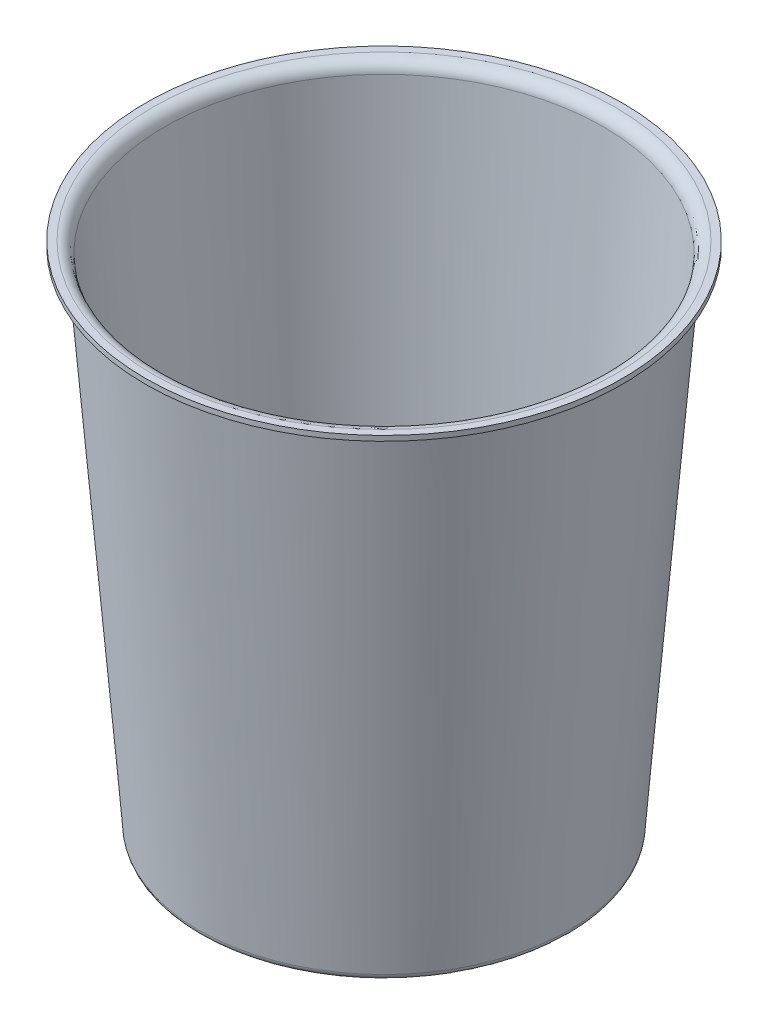
from build123d import *

# Parameters (mm, degrees)
SKETCH1_R           = 140
BOSS_EXTRUDE1_DEPTH = 300
FILLET1_R           = 4


# Read off the part's stored shape, not the designer's step: Shell1
with BuildPart() as part:
    # Sketch1 → Boss-Extrude1 (new body)
    with BuildSketch(Plane(origin=(0, 0, 0), x_dir=(1, 0, 0), z_dir=(0, 1, 0))):
        with Locations(Location((0, 0, 0), (0, 0, 270))):
            Circle(SKETCH1_R)
    extrude(amount=BOSS_EXTRUDE1_DEPTH)

    # Sketch3 → Cut-Revolve1 (revolve, cut)
    with BuildSketch(Plane.XY, mode=Mode.PRIVATE) as cut_revolve1_sk:
        with BuildLine():
            Line((-107.848101266, -4.321058688), (-131.736864002, 293.320012156))
            ThreePointArc((-131.736864002, 293.320012156), (-133.011114968, 295.939391827), (-135.72404248, 297))
            Line((-135.72404248, 297), (-179.746835443, 297))
            Line((-179.746835443, 297), (-193.472957422, -4.321058688))
            Line((-193.472957422, -4.321058688), (-107.848101266, -4.321058688))
        make_face()
    revolve(cut_revolve1_sk.sketch.rotate(Axis((0, -4.321058688, 0), (0, 1, 0)), 270), axis=Axis((0, -4.321058688, 0), (0, 1, 0)), mode=Mode.SUBTRACT)

    # Fillet1
    fillet1_edges = [part.edges().sort_by_distance(p)[0] for p in [
        (0, 0, 108.194910748),
    ]]
    fillet(fillet1_edges, radius=FILLET1_R)

    # Shell1 outline → Shell1 (revolve, cut)
    with BuildSketch(Plane.XY):
        with BuildLine():
            ThreePointArc((104.503089212, 3), (105.18132109, 3.265152043), (105.499883831, 3.919996961))
            Line((105.499883831, 3.919996961), (128.746480143, 293.560021272))
            ThreePointArc((128.746480143, 293.560021272), (130.976419333, 298.143935697), (135.72404248, 300))
            Line((135.72404248, 300), (0, 300))
            Line((0, 300), (0, 3))
            Line((0, 3), (104.503089212, 3))
        make_face()
    revolve(axis=Axis((0, 0, 0), (0, 1, 0)), mode=Mode.SUBTRACT)


solid = part.part
